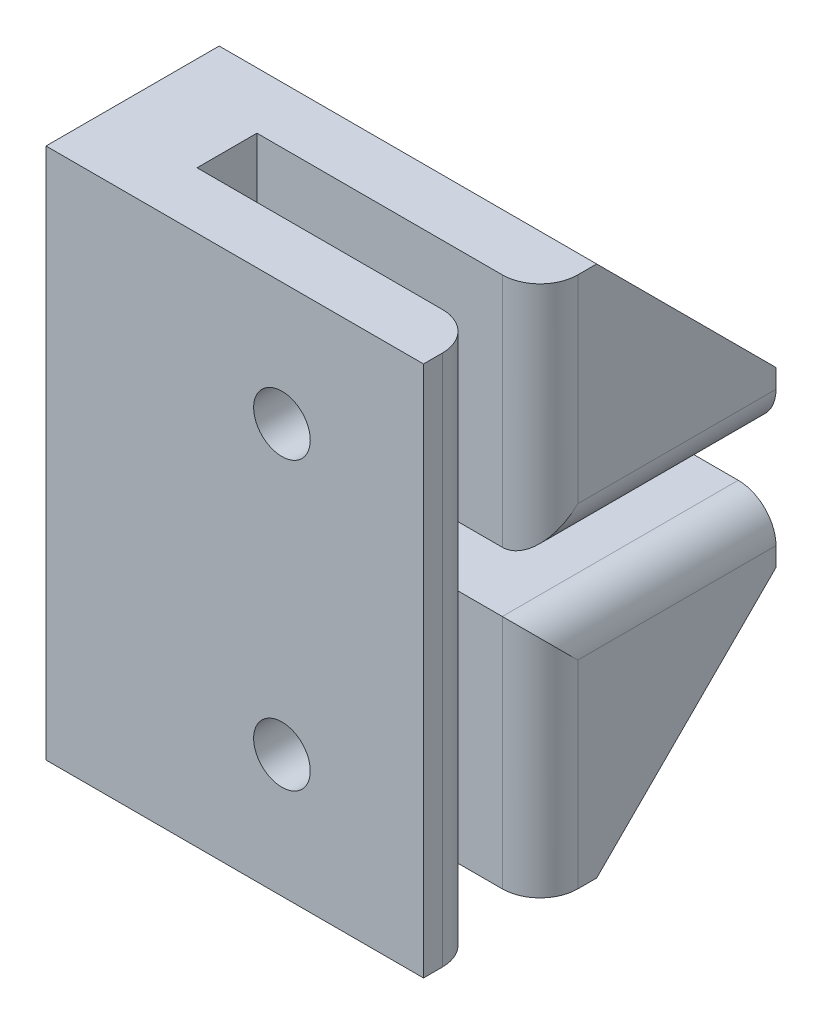
from build123d import *

# Parameters (mm, degrees)
BOSS_EXTRUDE1_DEPTH = 20
CUT_EXTRUDE1_DEPTH  = 15
FILLET1_R           = 2
SKETCH5_R           = 1.5
CUT_EXTRUDE4_DEPTH  = 32.535079673
SCALE1_SCALE        = 1.02


with BuildPart() as part:
    # Sketch1 → Boss-Extrude1 (new body)
    with BuildSketch(Plane(origin=(0, 0, 0), x_dir=(0, 0, -1), z_dir=(1, 0, 0))):
        Polygon((0, -12.5), (-3.175, -12.5), (-6.175, -12.5), (-6.175, 15.675), (-3.175, 15.675), (0, 15.675), (3, 15.675), (12.5, 6.175), (12.5, 3.175), (12.5, 0), (12.5, -3), (3, -12.5), align=None)
    extrude(amount=BOSS_EXTRUDE1_DEPTH)

    # Sketch2 → Cut-Extrude1 (cut)
    with BuildSketch(Plane(origin=(20, 0, 0), x_dir=(0, 0, -1), z_dir=(1, 0, 0))):
        Polygon((-3.175, -12.5), (0, -12.5), (0, 0), (12.5, 0), (12.5, 3.175), (0, 3.175), (0, 15.675), (-3.175, 15.675), (-3.175, 3.175), align=None)
    extrude(amount=-CUT_EXTRUDE1_DEPTH, mode=Mode.SUBTRACT)

    # Fillet1
    fillet1_edges = [part.edges().sort_by_distance(p)[0] for p in [
        (20, 1.5875, 3.175),
        (20, -6.25, 0),
        (20, 0, -6.25),
        (20, 3.175, -6.25),
        (20, 9.425, 0),
    ]]
    fillet(fillet1_edges, radius=FILLET1_R)

    # Sketch5 → Cut-Extrude4 (cut, through all)
    with BuildSketch(Plane.XY.offset(6.175)):
        with Locations((12.5, 9.175)):
            Circle(SKETCH5_R)
        with Locations((12.5, -6)):
            Circle(SKETCH5_R)
    extrude(amount=-CUT_EXTRUDE4_DEPTH, mode=Mode.SUBTRACT)


with BuildPart() as part_1:
    # Scale1: scaled about (9.096060395, 1.5875, -2.193637699)
    add(part.part.scale(SCALE1_SCALE).moved(Location((-0.181921208, -0.03175, 0.043872754))))


solid = part_1.part
